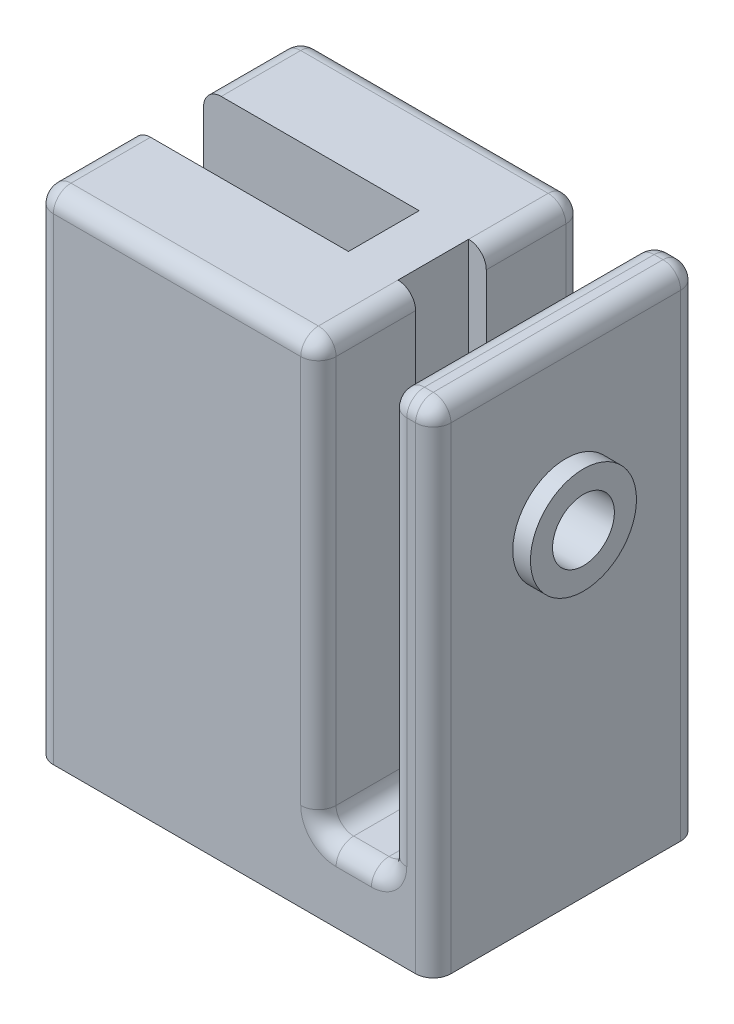
from build123d import *

# Parameters (mm, degrees)
ESQUISSE1_W                                    = 45
ESQUISSE1_H                                    = 30
BOSS_EXTRU_1_DEPTH                             = 8
ESQUISSE5_W                                    = 30
ESQUISSE5_H                                    = 48
BOSS_EXTRU_3_DEPTH                             = 32
ENL_V_MAT_EXTRU_1_DEPTH                        = 27
ESQUISSE14_W                                   = 6
ESQUISSE14_H                                   = 8
ENL_V_MAT_EXTRU_2_DEPTH                        = 67.708320321
D_GAGEMENT_M31_D                               = 3.2
D_GAGEMENT_M31_DEPTH                           = 7
D_GAGEMENT_M31_TIP                             = 0.96137699
ESQUISSE16_W                                   = 30
ESQUISSE16_H                                   = 48
ESQUISSE16_R                                   = 3.5
BOSS_EXTRU_4_DEPTH                             = 5
CONG_1_R                                       = 2
ESQUISSE17_W                                   = 10
ESQUISSE17_H                                   = 10
ENL_V_MAT_EXTRU_3_DEPTH                        = 2
BOSS_EXTRU_5_START                             = 2
ESQUISSE18_R                                   = 6
ESQUISSE18_R_2                                 = 3.5
BOSS_EXTRU_5_DEPTH                             = 2
FRAISAGE_POUR_VIS_T_TE_FRAIS_E_M31_D           = 3.4
FRAISAGE_POUR_VIS_T_TE_FRAIS_E_M31_CSINK_D     = 6.3
FRAISAGE_POUR_VIS_T_TE_FRAIS_E_M31_CSINK_ANGLE = 90
ESQUISSE24_W                                   = 8
ESQUISSE24_H                                   = 8
BOSS_EXTRU_6_DEPTH                             = 2.6


with BuildPart() as part:
    # Esquisse1 → Boss.-Extru.1 (new body)
    with BuildSketch(Plane(origin=(0, 0, 0), x_dir=(1, 0, 0), z_dir=(0, 1, 0))):
        with Locations((10.5, 0)):
            Rectangle(ESQUISSE1_W, ESQUISSE1_H)
    extrude(amount=BOSS_EXTRU_1_DEPTH)

    # Esquisse5 → Boss.-Extru.3 (add)
    with BuildSketch(Plane.ZY.offset(12)):
        with Locations((0, 32)):
            Rectangle(ESQUISSE5_W, ESQUISSE5_H)
    extrude(amount=-BOSS_EXTRU_3_DEPTH)

    # Esquisse6 → Enlèv. mat.-Extru.1 (cut)
    with BuildSketch(Plane.ZY.offset(12)):
        Polygon((10.25, 48), (4, 48), (4, 56), (-4, 56), (-4, 48), (-10.25, 48), (-10.25, 8), (10.25, 8), align=None)
    extrude(amount=-ENL_V_MAT_EXTRU_1_DEPTH, mode=Mode.SUBTRACT)

    # Esquisse14 → Enlèv. mat.-Extru.2 (cut, through all)
    with BuildSketch(Plane(origin=(0, 56, 0), x_dir=(1, 0, 0), z_dir=(0, 1, 0))):
        with Locations((21, 0)):
            Rectangle(ESQUISSE14_W, ESQUISSE14_H)
    extrude(amount=-ENL_V_MAT_EXTRU_2_DEPTH, mode=Mode.SUBTRACT)

    # Dégagement M31
    with Locations(Plane.ZY.offset(12)):
        with Locations((5, 4), (-5, 4)):
            Hole(D_GAGEMENT_M31_D / 2, depth=D_GAGEMENT_M31_DEPTH)
            with Locations((0, 0, -(D_GAGEMENT_M31_DEPTH + D_GAGEMENT_M31_TIP / 2))):  # 118° drill point
                Cone(0, D_GAGEMENT_M31_D / 2, D_GAGEMENT_M31_TIP, mode=Mode.SUBTRACT)

    # Esquisse16 → Boss.-Extru.4 (add)
    with BuildSketch(Plane(origin=(33, 0, 0), x_dir=(0, 0, -1), z_dir=(1, 0, 0))):
        with Locations((0, 32)):
            Rectangle(ESQUISSE16_W, ESQUISSE16_H)
        with Locations((0, 38)):
            Circle(ESQUISSE16_R, mode=Mode.SUBTRACT)
    extrude(amount=-BOSS_EXTRU_4_DEPTH)

    # Congé1
    cong_1_edges = [part.edges().sort_by_distance(p)[0] for p in [
        (24, 8, -15),
        (24, 8, 15),
        (33, 28, 15),
        (33, 28, -15),
        (-12, 28, 15),
        (-12, 28, -15),
        (-12, 56, -9.5),
        (-12, 56, 9.5),
        (20, 8, -9.5),
        (20, 8, 9.5),
        (4, 56, -15),
        (20, 32, -15),
        (4, 56, 15),
        (20, 32, 15),
        (20, 56, -9.5),
        (20, 56, 9.5),
        (30.5, 56, 15),
        (28, 56, 0),
        (30.5, 56, -15),
        (33, 56, 0),
        (28, 8, 0),
        (28, 32, -15),
        (28, 32, 15),
    ]]
    fillet(cong_1_edges, radius=CONG_1_R)

    # Esquisse17 → Enlèv. mat.-Extru.3 (cut)
    with BuildSketch(Plane.ZY.offset(-28)):
        with Locations((0, 38)):
            Rectangle(ESQUISSE17_W, ESQUISSE17_H)
    extrude(amount=-ENL_V_MAT_EXTRU_3_DEPTH, mode=Mode.SUBTRACT)

    # Esquisse18 → Boss.-Extru.5 (add)
    with BuildSketch(Plane(origin=(33, 0, 0), x_dir=(0, 0, -1), z_dir=(1, 0, 0)).offset(BOSS_EXTRU_5_START)):
        with Locations((0, 38)):
            Circle(ESQUISSE18_R)
        with Locations((0, 38)):
            Circle(ESQUISSE18_R_2, mode=Mode.SUBTRACT)
    extrude(amount=-BOSS_EXTRU_5_DEPTH)

    # Fraisage pour vis à tête fraisée M31 (through all)
    with Locations(Plane(origin=(0, 8, 0), x_dir=(1, 0, 0), z_dir=(0, 1, 0))):
        with Locations((-7.5, 0), (7.5, 0)):
            CounterSinkHole(FRAISAGE_POUR_VIS_T_TE_FRAIS_E_M31_D / 2, FRAISAGE_POUR_VIS_T_TE_FRAIS_E_M31_CSINK_D / 2, counter_sink_angle=FRAISAGE_POUR_VIS_T_TE_FRAIS_E_M31_CSINK_ANGLE)

    # Esquisse24 → Boss.-Extru.6 (add)
    with BuildSketch(Plane.ZY.offset(-15)):
        with Locations((0, 52)):
            Rectangle(ESQUISSE24_W, ESQUISSE24_H)
    extrude(amount=BOSS_EXTRU_6_DEPTH)


solid = part.part
